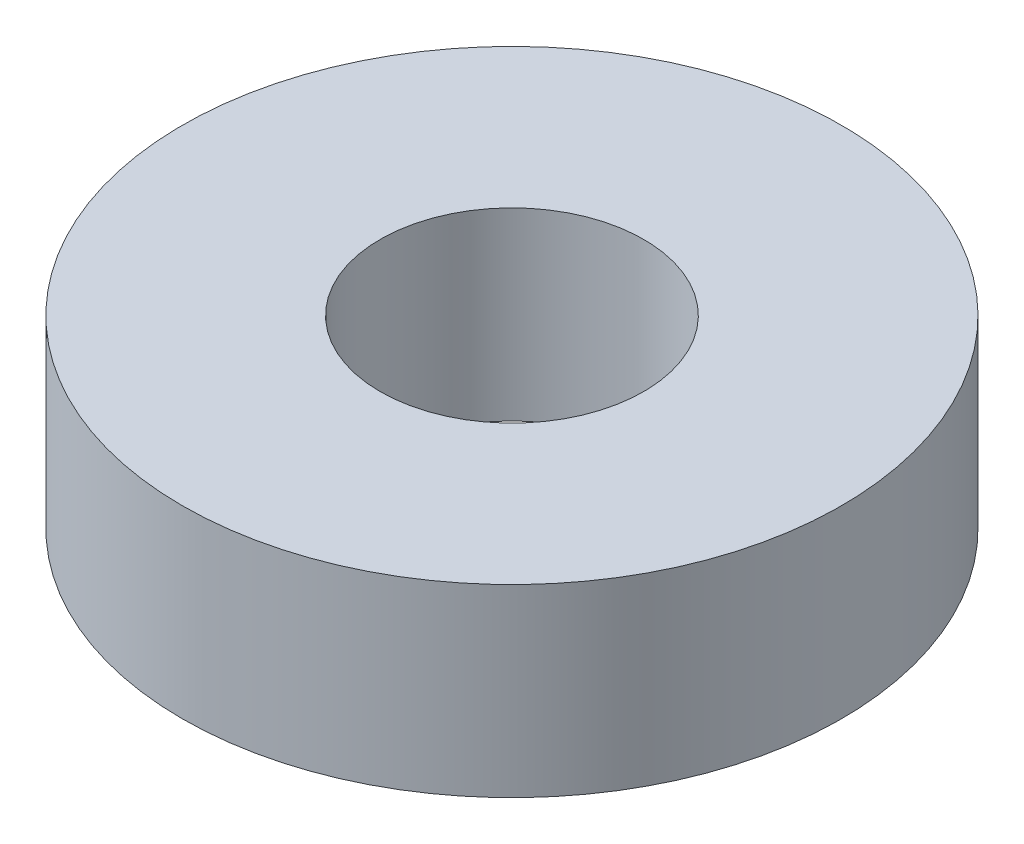
from build123d import *

# Parameters (mm, degrees)
SKETCH1_R           = 50
BOSS_EXTRUDE1_DEPTH = 28
SKETCH2_R           = 20
CUT_EXTRUDE1_DEPTH  = 77.052613367


with BuildPart() as part:
    # Sketch1 → Boss-Extrude1 (new body)
    with BuildSketch(Plane(origin=(0, 0, 0), x_dir=(1, 0, 0), z_dir=(0, 1, 0))):
        Circle(SKETCH1_R)
    extrude(amount=BOSS_EXTRUDE1_DEPTH)

    # Sketch2 → Cut-Extrude1 (cut, through all)
    with BuildSketch(Plane(origin=(0, 0, 0), x_dir=(1, 0, 0), z_dir=(0, 1, 0))):
        Circle(SKETCH2_R)
    extrude(amount=CUT_EXTRUDE1_DEPTH, mode=Mode.SUBTRACT)


solid = part.part
